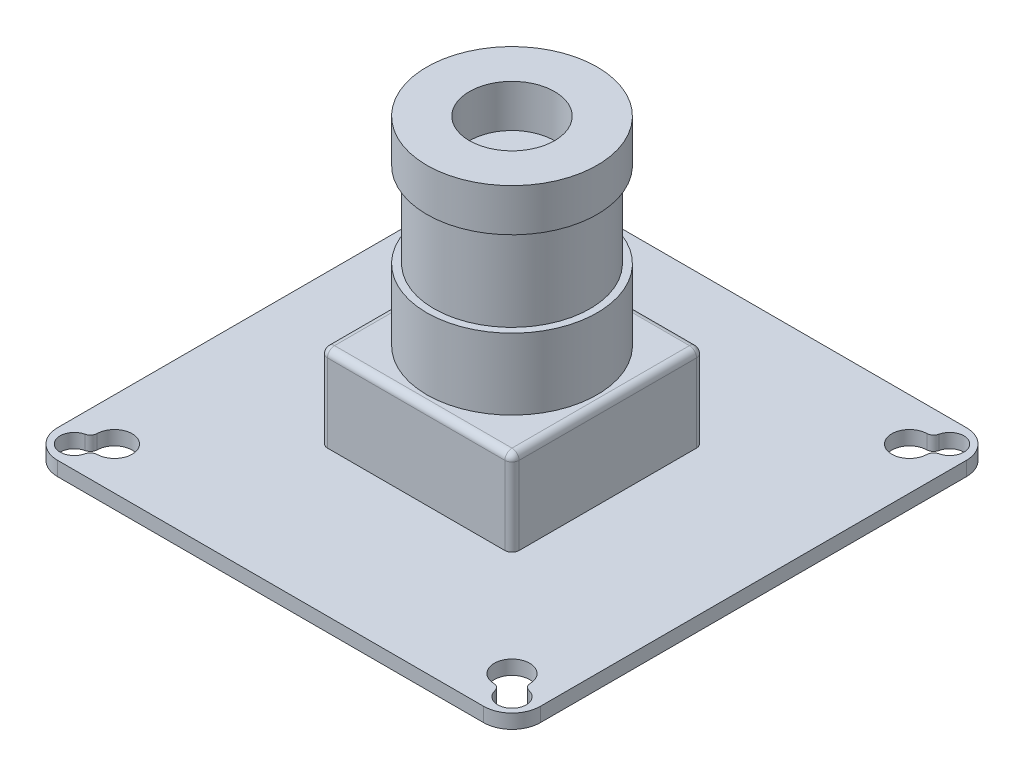
from build123d import *

# Parameters (mm, degrees)
SKETCH2_W           = 34
SKETCH2_H           = 34
BOSS_EXTRUDE2_DEPTH = 1
FILLET1_R           = 2
SKETCH3_W           = 13.5
SKETCH3_H           = 13.5
BOSS_EXTRUDE3_DEPTH = 6
SKETCH4_R           = 6
BOSS_EXTRUDE4_DEPTH = 5
FILLET2_R           = 0.5
SKETCH5_R           = 5.5
BOSS_EXTRUDE5_DEPTH = 6
SKETCH6_R           = 6
SKETCH6_R_2         = 3
BOSS_EXTRUDE6_DEPTH = 3
CUT_EXTRUDE1_DEPTH  = 32.272991542
FILLET3_R           = 0.5


with BuildPart() as part:
    # Sketch2 → Boss-Extrude2 (new body)
    with BuildSketch(Plane(origin=(0, 0, 0), x_dir=(1, 0, 0), z_dir=(0, 1, 0))):
        Rectangle(SKETCH2_W, SKETCH2_H)
    extrude(amount=BOSS_EXTRUDE2_DEPTH)

    # Fillet1
    fillet1_edges = [part.edges().sort_by_distance(p)[0] for p in [
        (-17, 0.5, -17),
        (17, 0.5, -17),
        (-17, 0.5, 17),
        (17, 0.5, 17),
    ]]
    fillet(fillet1_edges, radius=FILLET1_R)

    # Sketch3 → Boss-Extrude3 (add)
    with BuildSketch(Plane(origin=(0, 1, 0), x_dir=(1, 0, 0), z_dir=(0, 1, 0))):
        Rectangle(SKETCH3_W, SKETCH3_H)
    extrude(amount=BOSS_EXTRUDE3_DEPTH)

    # Sketch4 → Boss-Extrude4 (add)
    with BuildSketch(Plane(origin=(0, 7, 0), x_dir=(1, 0, 0), z_dir=(0, 1, 0))):
        Circle(SKETCH4_R)
    extrude(amount=BOSS_EXTRUDE4_DEPTH)

    # Fillet2
    fillet2_edges = [part.edges().sort_by_distance(p)[0] for p in [
        (-6.75, 7, 0),
        (0, 7, -6.75),
        (6.75, 7, 0),
        (0, 7, 6.75),
        (-6.75, 4, -6.75),
        (-6.75, 4, 6.75),
        (6.75, 4, -6.75),
        (6.75, 4, 6.75),
    ]]
    fillet(fillet2_edges, radius=FILLET2_R)

    # Sketch5 → Boss-Extrude5 (add)
    with BuildSketch(Plane(origin=(0, 12, 0), x_dir=(1, 0, 0), z_dir=(0, 1, 0))):
        Circle(SKETCH5_R)
    extrude(amount=BOSS_EXTRUDE5_DEPTH)

    # Sketch6 → Boss-Extrude6 (add)
    with BuildSketch(Plane(origin=(0, 18, 0), x_dir=(1, 0, 0), z_dir=(0, 1, 0))):
        Circle(SKETCH6_R)
        Circle(SKETCH6_R_2, mode=Mode.SUBTRACT)
    extrude(amount=BOSS_EXTRUDE6_DEPTH)

    # Sketch7 → Cut-Extrude1 (cut, through all)
    with BuildSketch(Plane(origin=(0, 1, 0), x_dir=(1, 0, 0), z_dir=(0, 1, 0))):
        with BuildLine():
            ThreePointArc((-15.168119812, 14.444967533), (-13.116116524, 13.116116524), (-14.444967533, 15.168119812))
            ThreePointArc((-14.444967533, 15.168119812), (-16.121320344, 16.121320344), (-15.168119812, 14.444967533))
        make_face()
        with BuildLine():
            ThreePointArc((14.444967533, 15.168119812), (13.116116524, 13.116116524), (15.168119812, 14.444967533))
            ThreePointArc((15.168119812, 14.444967533), (16.121320344, 16.121320344), (14.444967533, 15.168119812))
        make_face()
        with BuildLine():
            ThreePointArc((15.168119812, -14.444967533), (13.116116524, -13.116116524), (14.444967533, -15.168119812))
            ThreePointArc((14.444967533, -15.168119812), (16.121320344, -16.121320344), (15.168119812, -14.444967533))
        make_face()
        with BuildLine():
            ThreePointArc((-14.444967533, -15.168119812), (-13.116116524, -13.116116524), (-15.168119812, -14.444967533))
            ThreePointArc((-15.168119812, -14.444967533), (-16.121320344, -16.121320344), (-14.444967533, -15.168119812))
        make_face()
    extrude(amount=-CUT_EXTRUDE1_DEPTH, mode=Mode.SUBTRACT)

    # Fillet3
    fillet3_edges = [part.edges().sort_by_distance(p)[0] for p in [
        (15.168119812, 0.5, -14.444967533),
        (14.444967533, 0.5, -15.168119812),
        (14.444967533, 0.5, 15.168119812),
        (15.168119812, 0.5, 14.444967533),
        (-14.444967533, 0.5, 15.168119812),
        (-15.168119812, 0.5, 14.444967533),
        (-14.444967533, 0.5, -15.168119812),
        (-15.168119812, 0.5, -14.444967533),
    ]]
    fillet(fillet3_edges, radius=FILLET3_R)


solid = part.part
